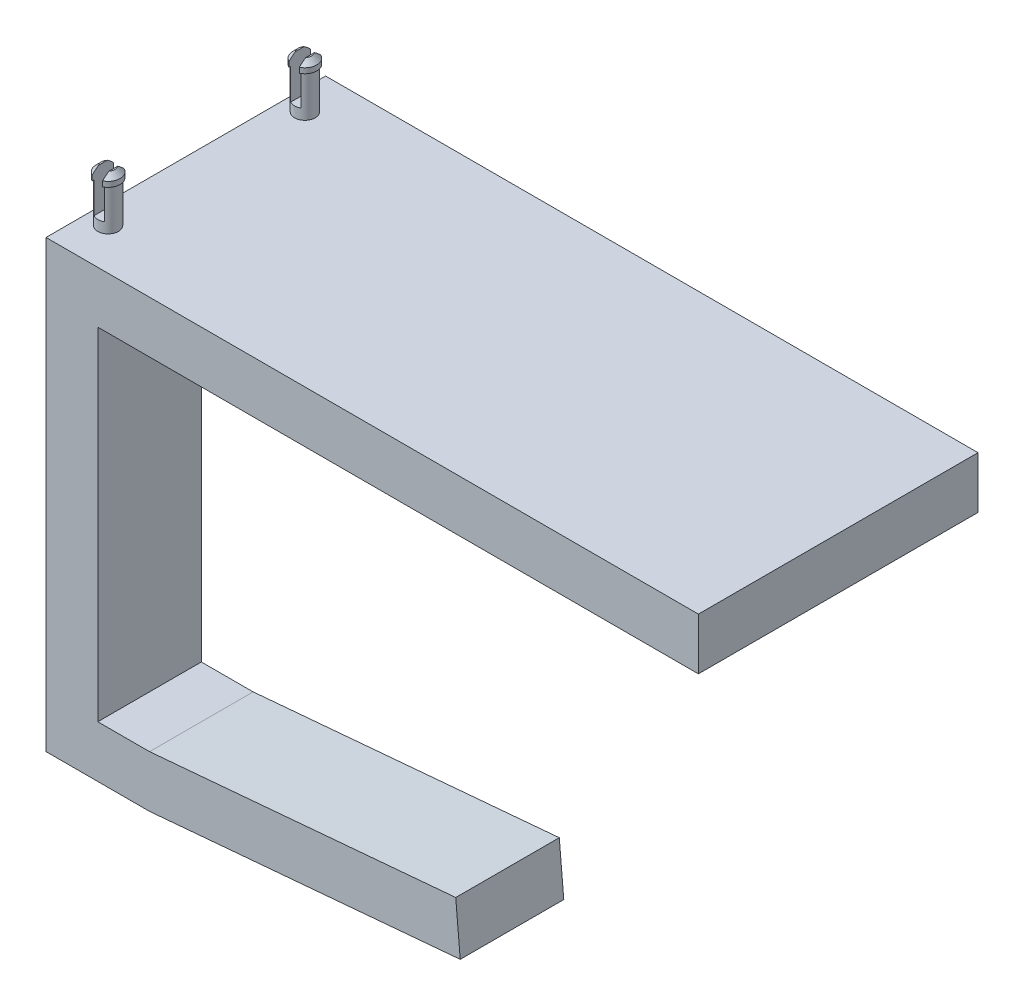
from build123d import *

# Parameters (mm, degrees)
BOSS_EXTRUDE1_DEPTH = 5
SKETCH3_W           = 63
SKETCH3_H           = 27
BOSS_EXTRUDE3_DEPTH = 2.5
SKETCH4_R           = 1
BOSS_EXTRUDE6_DEPTH = 4
SKETCH5_W           = 1
SKETCH5_H           = 3.04418771
CUT_EXTRUDE1_DEPTH  = 3
SKETCH6_R           = 1.15
BOSS_EXTRUDE7_DEPTH = 1
CHAMFER1_SIZE       = 0.5
SKETCH7_W           = 1
SKETCH7_H           = 2.786400566
CUT_EXTRUDE3_DEPTH  = 1
MIRROR2_START       = 47
MIRROR2_DEPTH       = 1


with BuildPart() as part:
    # Sketch1 → Boss-Extrude1 (new, symmetric)
    with BuildSketch(Plane.XY):
        Polygon((0, 0), (10, 0), (40, 2.624659906), (39.566186352, 7.583172591), (10, 4.996466462), (5, 4.996466462), (5, 38.996466462), (50, 38.996466462), (50, 43), (0, 43), align=None)
    extrude(amount=BOSS_EXTRUDE1_DEPTH, both=True)

    # Sketch3 → Boss-Extrude3 (add, symmetric)
    with BuildSketch(Plane(origin=(0, 40.5, 0), x_dir=(1, 0, 0), z_dir=(0, 1, 0))):
        with Locations((31.5, 8.5)):
            Rectangle(SKETCH3_W, SKETCH3_H)
    extrude(amount=BOSS_EXTRUDE3_DEPTH, both=True)

    # Sketch4 → Boss-Extrude6 (add)
    with BuildSketch(Plane(origin=(0, 43, 0), x_dir=(1, 0, 0), z_dir=(0, 1, 0))):
        with Locations(Location((2, -1, 0), (0, 0, 90))):
            Circle(SKETCH4_R)
        with Locations(Location((2, 18, 0), (0, 0, 90))):
            Circle(SKETCH4_R)
    extrude(amount=BOSS_EXTRUDE6_DEPTH)

    # Sketch5 → Cut-Extrude1 (cut)
    with BuildSketch(Plane(origin=(0, 47, 0), x_dir=(1, 0, 0), z_dir=(0, 1, 0))):
        with Locations((2, -1)):
            Rectangle(SKETCH5_W, SKETCH5_H)
    cut_extrude1 = extrude(amount=-CUT_EXTRUDE1_DEPTH, mode=Mode.SUBTRACT)

    # Mirror1: Cut-Extrude1 across plane
    add(cut_extrude1.mirror(Plane.XY.offset(-8.5)), mode=Mode.SUBTRACT)

    # Sketch6 → Boss-Extrude7 (add)
    with BuildSketch(Plane(origin=(0, 47, 0), x_dir=(1, 0, 0), z_dir=(0, 1, 0))):
        with Locations(Location((2, -1, 0), (0, 0, 270))):
            Circle(SKETCH6_R)
    extrude(amount=BOSS_EXTRUDE7_DEPTH)

    # Chamfer1
    chamfer1_edges = [part.edges().sort_by_distance(p)[0] for p in [
        (2, 48, -0.15),
    ]]
    chamfer(chamfer1_edges, length=CHAMFER1_SIZE)

    # Sketch7 → Cut-Extrude3 (cut)
    with BuildSketch(Plane(origin=(0, 48, 0), x_dir=(1, 0, 0), z_dir=(0, 1, 0))):
        with Locations((2, -1)):
            Rectangle(SKETCH7_W, SKETCH7_H)
    extrude(amount=-CUT_EXTRUDE3_DEPTH, mode=Mode.SUBTRACT)

    # Mirror2: read off the stored shape, not the designer's step
    # Mirror2 outline → Mirror2 (add)
    with BuildSketch(Plane(origin=(0, 0, 0), x_dir=(1, 0, 0), z_dir=(0, 1, 0)).offset(MIRROR2_START)):
        with BuildLine():
            ThreePointArc((2.5, 16.964384241), (3.15, 18), (2.5, 19.035615759))
            Line((2.5, 19.035615759), (2.5, 16.964384241))
        make_face()
        with BuildLine():
            ThreePointArc((1.5, 19.035615759), (0.85, 18), (1.5, 16.964384241))
            Line((1.5, 16.964384241), (1.5, 19.035615759))
        make_face()
    extrude(amount=MIRROR2_DEPTH)

    # Mirror2 2 outline → Mirror2 2 (revolve, cut)
    with BuildSketch(Plane(origin=(2, 0, -18), x_dir=(1, 0, 0), z_dir=(0, 0, 1))):
        Polygon((1.150000012, 48.000000304), (0.649999696, 48.000000304), (1.150000012, 47.499999988), align=None)
    revolve(axis=Axis((2, 0, -18), (0, 1, 0)), mode=Mode.SUBTRACT)


solid = part.part
